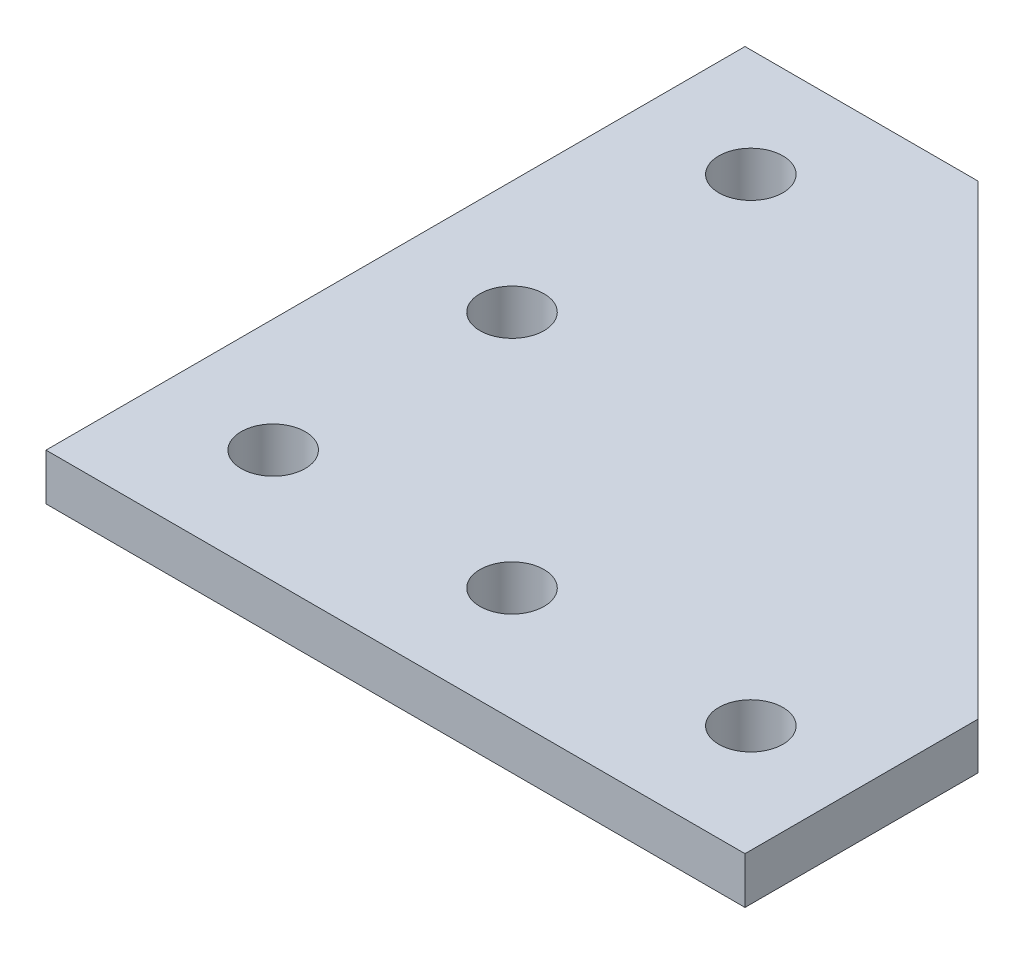
from build123d import *

# Parameters (mm, degrees)
BOSS_EXTRUDE1_DEPTH  = 2
SKETCH3_R            = 2.75
CUT_EXTRUDE1_DEPTH   = 71.823724839
LPATTERN1_COUNT      = 3
LPATTERN1_PITCH      = 20.5
LPATTERN1_COUNT_DIR2 = 3
LPATTERN1_PITCH_DIR2 = 20.5


with BuildPart() as part:
    # Sketch2 → Boss-Extrude1 (new, symmetric)
    with BuildSketch(Plane(origin=(0, 0, 0), x_dir=(1, 0, 0), z_dir=(0, 1, 0))):
        Polygon((-10, -10), (50, -10), (50, 10), (10, 50), (-10, 50), align=None)
    extrude(amount=BOSS_EXTRUDE1_DEPTH, both=True)

    # Sketch3 → Cut-Extrude1 (cut, symmetric)
    with BuildSketch(Plane(origin=(0, 2, 0), x_dir=(1, 0, 0), z_dir=(0, 1, 0))):
        with Locations((-0.25, -0.25)):
            Circle(SKETCH3_R)
    cut_extrude1 = extrude(amount=CUT_EXTRUDE1_DEPTH, both=True, mode=Mode.SUBTRACT)

    # LPattern1: Cut-Extrude1 3 × 3, 4 skipped
    with Locations(*[(j * LPATTERN1_PITCH_DIR2, 0, -i * LPATTERN1_PITCH) for i in range(LPATTERN1_COUNT) for j in range(LPATTERN1_COUNT_DIR2) if (i, j) not in ((0, 0), (1, 1), (1, 2), (2, 1), (2, 2))]):
        add(cut_extrude1, mode=Mode.SUBTRACT)


solid = part.part
